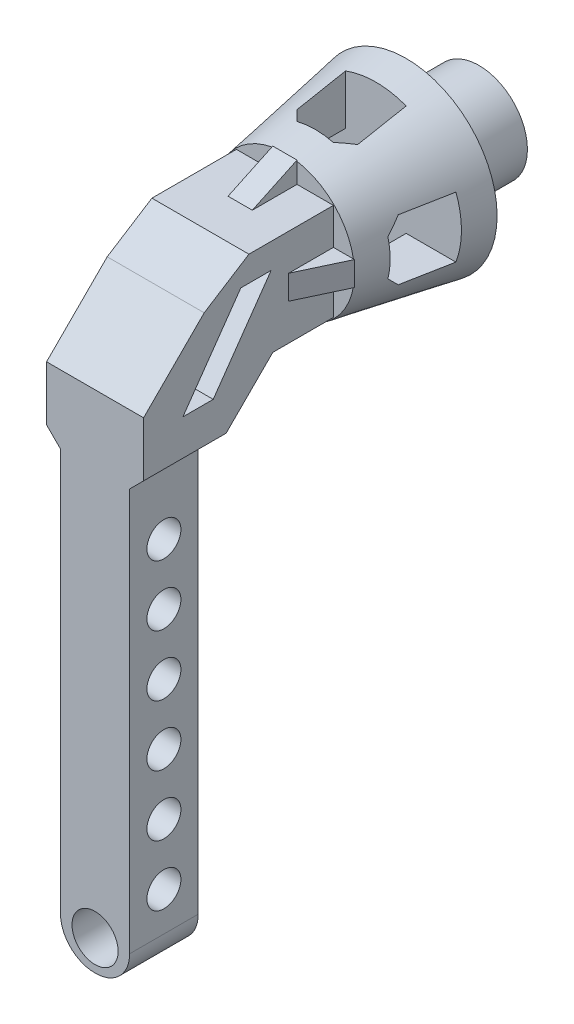
from build123d import *

# Parameters (mm, degrees)
SKETCH_1_R               = 4
SKETCH_1_R_2             = 2.5
EXTRUDE_1_DEPTH          = 6
SKETCH_2_R               = 7.5
EXTRUDE_2_DEPTH          = 10
EXTRUDE_2_TAPER          = 10
CHAMFER_1_SIZE           = 1
SWEEP_1_PITCH            = 0.8
SWEEP_1_FROM             = 0
SKETCH_7_W               = 8
SKETCH_7_H               = 8
EXTRUDE_5_DEPTH          = 5
EXTRUDE_6_DEPTH          = 8
SKETCH_13_W              = 8
SKETCH_13_H              = 8
EXTRUDE_7_DEPTH          = 7.07
EXTRUDE_8_DEPTH          = 8
SKETCH_16_W              = 5.7
SKETCH_16_H              = 5.656854249
EXTRUDE_9_DEPTH          = 31
SKETCH_17_W              = 5.7
SKETCH_17_H              = 5
SKETCH_17_R              = 1.9
EXTRUDE_10_DEPTH         = 5.656854249
FILLET_1_R               = 2.8
CUT_EXTRUDE_2_DEPTH      = 57.207567654
CHAMFER_2_SIZE           = 1.15
EXTRUDE_11_DEPTH         = 1
EXTRUDE_11_DEPTH_BACK    = 1
EXTRUDE_12_DEPTH         = 1
EXTRUDE_12_DEPTH_BACK    = 1
CUT_EXTRUDE_3_DEPTH      = 10
CUT_EXTRUDE_3_DEPTH_BACK = 10
SKETCH_21_W              = 5
SKETCH_21_H              = 5
CUT_EXTRUDE_4_DEPTH      = 10
CUT_EXTRUDE_4_DEPTH_BACK = 10
SKETCH_22_W              = 5
SKETCH_22_H              = 5
CHAMFER_4_SIZE           = 1
SKETCH_23_R              = 2.5
CUT_EXTRUDE_5_DEPTH      = 2
CHAMFER_5_SIZE           = 2
CUT_EXTRUDE_8_DEPTH      = 10
SKETCH_26_R              = 1.4
CUT_EXTRUDE_9_DEPTH      = 10


with BuildPart() as part:
    # 草图1 → 凸台-拉伸1 (new body)
    with BuildSketch(Plane.XY):
        Circle(SKETCH_1_R)
        Circle(SKETCH_1_R_2, mode=Mode.SUBTRACT)
    extrude(amount=EXTRUDE_1_DEPTH)

    # 草图2 → 凸台-拉伸2 (add)
    with BuildSketch(Plane.XY.offset(6)):
        Circle(SKETCH_2_R)
    extrude(amount=EXTRUDE_2_DEPTH, taper=EXTRUDE_2_TAPER)

    # 倒角1
    chamfer_1_edges = [part.edges().sort_by_distance(p)[0] for p in [
        (-2.5, 0, 0),
    ]]
    chamfer(chamfer_1_edges, length=CHAMFER_1_SIZE)

    # 切除-扫描1: arcs per turn and ends read off the stored shape
    # 切除-扫描1: the profile of 草图6 screwed along a left-hand helix through 8 turns, 8 arcs to a turn; built about Z, then put on its axis
    sweep_1_z = Axis((0, 0, 0), (0, 0, 1))
    sweep_1_corners = [(2.513437751, 0.010149744, -0.600710237), (2.486562249, -0.010149744, -0.999289763), (2.845627372, -0.001183845, -0.823244741)]
    with BuildLine(mode=Mode.PRIVATE) as sweep_1_profile:
        Line(sweep_1_corners[0], sweep_1_corners[1])
        Line(sweep_1_corners[1], sweep_1_corners[2])
        Line(sweep_1_corners[2], sweep_1_corners[0])
    sweep_1_cap = Face(sweep_1_profile.wire())
    sweep_1_turn_angles = [0, -22.5, -45, -67.5, -90, -112.5, -135, -157.5, -180, -202.5, -225, -247.5, -270, -292.5, -315, -337.5, -360]
    sweep_1_turn_weights = [1, 0.9238795325112867, 1, 0.9238795325112867, 1, 0.9238795325112867, 1, 0.9238795325112867, 1, 0.9238795325112867, 1, 0.9238795325112867, 1, 0.9238795325112867, 1, 0.9238795325112867, 1]
    sweep_1_turn_rails = [Edge.make_bspline([Vector(p[0], p[1], 0).rotate(sweep_1_z, sweep_1_turn_angles[k]) / sweep_1_turn_weights[k] + Vector(0, 0, p[2] + -SWEEP_1_PITCH * sweep_1_turn_angles[k] / 360) for k in range(17)], [0, 0, 0, 1, 1, 2, 2, 3, 3, 4, 4, 5, 5, 6, 6, 7, 7, 8, 8, 8], 2, sweep_1_turn_weights) for p in sweep_1_corners]
    sweep_1_turn_sides = [Face.make_surface_from_curves(sweep_1_turn_rails[p[0]], sweep_1_turn_rails[p[1]]) for p in [(0, 1), (1, 2), (2, 0)]]
    sweep_1 = Plane(origin=(0, 0, 6), x_dir=(0.7071067811865512, 0.7071067811865438, 0), z_dir=(0, 0, -1)) * split(Solid(Shell([*[p.moved(Location((0, 0, SWEEP_1_PITCH * i))) for i in range(8) for p in sweep_1_turn_sides], sweep_1_cap, sweep_1_cap.rotate(sweep_1_z, -2880).moved(Location((0, 0, -SWEEP_1_PITCH * -2880 / 360)))])), bisect_by=Plane.XY.offset(SWEEP_1_FROM), keep=Keep.TOP, mode=Mode.PRIVATE)
    add(sweep_1, mode=Mode.SUBTRACT)

    # 草图7 → 凸台-拉伸5 (add)
    with BuildSketch(Plane.XY.offset(16)):
        Rectangle(SKETCH_7_W, SKETCH_7_H)
    extrude(amount=EXTRUDE_5_DEPTH)

    # 草图12 → 凸台-拉伸6 (add)
    with BuildSketch(Plane.ZY.offset(4)):
        Polygon((21, 4), (21, -4), (29, 4), align=None)
    extrude(amount=-EXTRUDE_6_DEPTH)

    # 草图13 → 凸台-拉伸7 (add)
    with BuildSketch(Plane(origin=(0, -12.5, 12.5), x_dir=(1, 0, 0), z_dir=(0, -0.7071067811865693, 0.7071067811865258))):
        with Locations((0, 16.02081528)):
            Rectangle(SKETCH_13_W, SKETCH_13_H)
    extrude(amount=EXTRUDE_7_DEPTH)

    # 草图15 → 凸台-拉伸8 (add)
    with BuildSketch(Plane.ZY.offset(4)):
        Polygon((31.656099192, -3.342390693), (31.656099192, -8.999244943), (25.999244943, -8.999244943), align=None)
    extrude(amount=-EXTRUDE_8_DEPTH)

    # 草图16 → 凸台-拉伸9 (add)
    with BuildSketch(Plane.XZ.offset(8.999244943)):
        with Locations((0, 28.827672068)):
            Rectangle(SKETCH_16_W, SKETCH_16_H)
    extrude(amount=EXTRUDE_9_DEPTH)

    # 草图17 → 凸台-拉伸10 (add)
    with BuildSketch(Plane(origin=(0, 0, 25.999244943), x_dir=(-1, 0, 0), z_dir=(0, 0, -1))):
        with Locations((0, -42.499244943)):
            Rectangle(SKETCH_17_W, SKETCH_17_H)
        with Locations((0, -42.499244943)):
            Circle(SKETCH_17_R, mode=Mode.SUBTRACT)
    extrude(amount=-EXTRUDE_10_DEPTH)

    # 圆角1
    fillet_1_edges = [part.edges().sort_by_distance(p)[0] for p in [
        (-2.85, -44.999244943, 28.827672067),
        (2.85, -44.999244943, 28.827672067),
    ]]
    fillet(fillet_1_edges, radius=FILLET_1_R)

    # 草图18 → 切除-拉伸2 (cut, through all)
    with BuildSketch(Plane(origin=(4, 0, 0), x_dir=(0, 0, -1), z_dir=(1, 0, 0))):
        Polygon((-26.656854249, 1.656854249), (-22.968781508, 4), (-29, 4), align=None)
    extrude(amount=-CUT_EXTRUDE_2_DEPTH, mode=Mode.SUBTRACT)

    # 倒角2
    chamfer_2_edges = [part.edges().sort_by_distance(p)[0] for p in [
        (4, -8.999244943, 28.827672068),
        (-4, -8.999244943, 28.827672068),
    ]]
    chamfer(chamfer_2_edges, length=CHAMFER_2_SIZE - 0.0001)  # a hair under: the kernel refuses the full size

    # 草图19 → 凸台-拉伸11 (add, two sides: drawn at the far end of the back side and taken through both)
    with BuildSketch(Plane(origin=(0, 0, 0), x_dir=(1, 0, 0), z_dir=(0, 1, 0)).offset(-EXTRUDE_11_DEPTH_BACK)):
        Polygon((-5.736730193, -16), (-4, -19.690245422), (-4, -16), align=None)
        Polygon((4, -16), (4, -19.690245422), (5.736730193, -16), align=None)
    extrude(amount=EXTRUDE_11_DEPTH + EXTRUDE_11_DEPTH_BACK)

    # 草图20 → 凸台-拉伸12 (add, two sides: drawn at the far end of the back side and taken through both)
    with BuildSketch(Plane(origin=(0, 0, 0), x_dir=(0, 0, -1), z_dir=(1, 0, 0)).offset(-EXTRUDE_12_DEPTH_BACK)):
        Polygon((-19.690245422, -4), (-16, -5.736730193), (-16, -4), align=None)
        Polygon((-19.690245422, 4), (-16, 5.736730193), (-16, 4), align=None)
    extrude(amount=EXTRUDE_12_DEPTH + EXTRUDE_12_DEPTH_BACK)

    # 草图21 → 切除-拉伸3 (cut, two sides: drawn at the far end of the back side and taken through both)
    with BuildSketch(Plane(origin=(0, 0, 0), x_dir=(1, 0, 0), z_dir=(0, 1, 0)).offset(-CUT_EXTRUDE_3_DEPTH_BACK)):
        with Locations((0, -11)):
            Rectangle(SKETCH_21_W, SKETCH_21_H)
    extrude(amount=CUT_EXTRUDE_3_DEPTH + CUT_EXTRUDE_3_DEPTH_BACK, mode=Mode.SUBTRACT)

    # 草图22 → 切除-拉伸4 (cut, two sides: drawn at the far end of the back side and taken through both)
    with BuildSketch(Plane(origin=(0, 0, 0), x_dir=(0, 0, -1), z_dir=(1, 0, 0)).offset(-CUT_EXTRUDE_4_DEPTH_BACK)):
        with Locations((-11, 0)):
            Rectangle(SKETCH_22_W, SKETCH_22_H)
    extrude(amount=CUT_EXTRUDE_4_DEPTH + CUT_EXTRUDE_4_DEPTH_BACK, mode=Mode.SUBTRACT)

    # 倒角4
    chamfer_4_edges = [part.edges().sort_by_distance(p)[0] for p in [
        (2.5, -4.07453956, 13.5),
        (4.07453956, -2.5, 13.5),
        (4.07453956, 2.5, 13.5),
        (2.5, 4.07453956, 13.5),
        (-2.5, 4.07453956, 13.5),
        (-4.07453956, 2.5, 13.5),
        (-2.5, -4.07453956, 13.5),
        (-4.07453956, -2.5, 13.5),
    ]]
    chamfer(chamfer_4_edges, length=CHAMFER_4_SIZE)

    # 草图23 → 切除-拉伸5 (cut)
    with BuildSketch(Plane(origin=(0, 0, 6), x_dir=(-1, 0, 0), z_dir=(0, 0, -1))):
        Circle(SKETCH_23_R)
    extrude(amount=-CUT_EXTRUDE_5_DEPTH, mode=Mode.SUBTRACT)

    # 倒角5
    chamfer_5_edges = [part.edges().sort_by_distance(p)[0] for p in [
        (2.5, 0, 8),
    ]]
    chamfer(chamfer_5_edges, length=CHAMFER_5_SIZE - 0.0001)  # a hair under: the kernel refuses the full size

    # 草图24 → 切除-拉伸8 (cut)
    with BuildSketch(Plane.ZY.offset(4)):
        Polygon((21.13776921, 1.923510989), (23.63776921, 1.923510989), (28.413936913, -4.897563397), (25.913936913, -4.897563397), align=None)
    extrude(amount=-CUT_EXTRUDE_8_DEPTH, mode=Mode.SUBTRACT)

    # 草图26 → 切除-拉伸9 (cut)
    with BuildSketch(Plane(origin=(2.85, 0, 0), x_dir=(0, 0, -1), z_dir=(1, 0, 0))):
        with Locations((-28.827672068, -13.999244943)):
            Circle(SKETCH_26_R)
        with Locations((-28.827672068, -18.999244943)):
            Circle(SKETCH_26_R)
        with Locations((-28.827672068, -23.999244943)):
            Circle(SKETCH_26_R)
        with Locations((-28.827672068, -28.999244943)):
            Circle(SKETCH_26_R)
        with Locations((-28.827672068, -33.999244943)):
            Circle(SKETCH_26_R)
        with Locations((-28.827672068, -38.999244943)):
            Circle(SKETCH_26_R)
    extrude(amount=-CUT_EXTRUDE_9_DEPTH, mode=Mode.SUBTRACT)


solid = part.part
